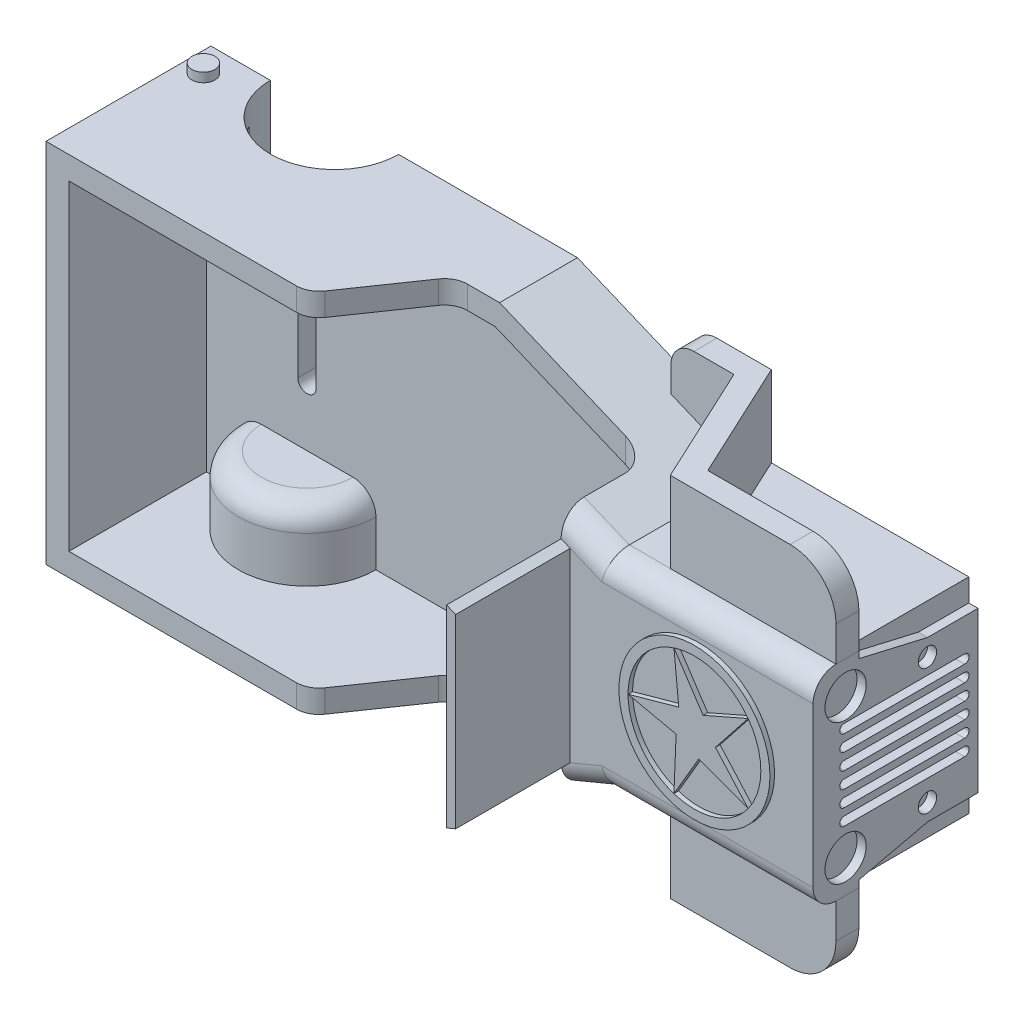
from build123d import *

# Parameters (mm, degrees)
BOSS_EXTRUDE1_DEPTH     = 6
BOSS_EXTRUDE2_DEPTH     = 30
FILLET1_R               = 5
SHELL1_START            = -1
SHELL1_DEPTH            = 26
BOSS_EXTRUDE3_DEPTH     = 30
CUT_EXTRUDE1_DEPTH      = 147.225446215
CUT_EXTRUDE1_DEPTH_BACK = 147.225446215
FILLET2_R               = 5
BOSS_EXTRUDE8_DEPTH     = 15
CUT_EXTRUDE4_DEPTH      = 15
BOSS_EXTRUDE10_START    = -5
BOSS_EXTRUDE10_DEPTH    = 5
FILLET3_R               = 5
FILLET3_OF_MIRROR1_R    = 5
BOSS_EXTRUDE11_REACH    = 163.808
FILLET4_R               = 5
FILLET5_R               = 10
SKETCH16_R              = 4.5
SKETCH16_R_2            = 2
CUT_EXTRUDE5_DEPTH      = 2
CUT_EXTRUDE6_DEPTH      = 2
LPATTERN1_COUNT         = 6
LPATTERN1_PITCH         = 3.5
CUT_EXTRUDE7_DEPTH      = 15
SKETCH19_R              = 2.5
BOSS_EXTRUDE12_DEPTH    = 2
SKETCH20_R              = 3
SKETCH20_R_2            = 2
BOSS_EXTRUDE13_DEPTH    = 2
SKETCH21_R              = 16.488787197
SKETCH21_R_2            = 14.488787197
BOSS_EXTRUDE14_DEPTH    = 1
BOSS_EXTRUDE15_DEPTH    = 25
BOSS_EXTRUDE16_REACH    = 162.079
SKETCH23_W              = 1.975463427
SKETCH23_H              = 1.767939341
BOSS_EXTRUDE17_REACH    = 162.079
SKETCH25_W              = 1.975463427
SKETCH25_H              = 1.028390585
SKETCH26_W              = 22.203670074
SKETCH26_H              = 37.955265754
BOSS_EXTRUDE25_DEPTH    = 2
SKETCH27_R              = 2.5
BOSS_EXTRUDE26_DEPTH    = 11
FILLET6_R               = 1


# Read off the part's stored shape, not the designer's step: Shell1
with BuildPart() as part:
    # Sketch1 → Boss-Extrude1 (new body)
    with BuildSketch(Plane.XY):
        Polygon((-30, -40), (-30, 40), (50, 40), (92.319783532, 22.378793205), (137.411357321, 22.378793205), (137.411357321, -22.378793205), (92.319783532, -22.378793205), (50, -40), align=None)
    extrude(amount=-BOSS_EXTRUDE1_DEPTH)

    # Sketch2 → Boss-Extrude2 (add)
    with BuildSketch(Plane.XY):
        Polygon((82.432198457, 26.495808151), (82.432198457, -26.495808151), (92.319783532, -22.378793205), (137.411357321, -22.378793205), (137.411357321, 22.378793205), (92.319783532, 22.378793205), align=None)
    extrude(amount=BOSS_EXTRUDE2_DEPTH)

    # Fillet1
    fillet1_edges = [part.edges().sort_by_distance(p)[0] for p in [
        (114.865570426, 22.378793205, 30),
        (114.865570426, -22.378793205, 30),
        (87.375990995, 24.437300678, 30),
        (87.375990995, -24.437300678, 30),
    ]]
    fillet(fillet1_edges, radius=FILLET1_R)

    # Shell1 outline → Shell1 (cut)
    with BuildSketch(Plane.XY.offset(SHELL1_START)):
        Polygon((82.432198457, 21.079688275), (82.432198457, -21.079688275), (91.320413667, -17.378793205), (132.411357321, -17.378793205), (132.411357321, 17.378793205), (91.320413667, 17.378793205), align=None)
    extrude(amount=SHELL1_DEPTH, mode=Mode.SUBTRACT)

    # Sketch3 → Boss-Extrude3 (add)
    with BuildSketch(Plane.XY):
        Polygon((82.432198457, 21.079688275), (82.432198457, 26.495808151), (50, 40), (-30, 40), (-30, -40), (50, -40), (82.432198457, -26.495808151), (82.432198457, -21.079688275), (49.000630135, -35), (-25, -35), (-25, 35), (49.000630135, 35), align=None)
    extrude(amount=BOSS_EXTRUDE3_DEPTH)

    # Sketch4 → Cut-Extrude1 (cut, two sides: drawn at the far end of the back side and taken through both)
    with BuildSketch(Plane(origin=(0, 0, 0), x_dir=(1, 0, 0), z_dir=(0, 1, 0)).offset(-CUT_EXTRUDE1_DEPTH_BACK)):
        Polygon((82.432198457, -30), (82.432198457, -11), (40.350619209, -11), (27.257423669, -30), align=None)
    extrude(amount=CUT_EXTRUDE1_DEPTH + CUT_EXTRUDE1_DEPTH_BACK, mode=Mode.SUBTRACT)

    # Fillet2
    fillet2_edges = [part.edges().sort_by_distance(p)[0] for p in [
        (27.257423669, 37.5, 30),
        (40.350619209, -37.5, 11),
        (40.350619209, 37.5, 11),
        (27.257423669, -37.5, 30),
        (82.432198457, -23.787748213, 11),
        (82.432198457, 23.787748213, 11),
    ]]
    fillet(fillet2_edges, radius=FILLET2_R)

    # Sketch10 → Boss-Extrude8 (add)
    with BuildSketch(Plane.XZ.offset(-35)):
        with BuildLine():
            Line((-17.996298407, 0), (-15.996298407, 0))
            ThreePointArc((-15.996298407, 0), (-2.996298407, 13), (10.003701593, 0))
            Line((10.003701593, 0), (12.003701593, 0))
            ThreePointArc((12.003701593, 0), (-2.996298407, 15), (-17.996298407, 0))
        make_face()
    boss_extrude8 = extrude(amount=BOSS_EXTRUDE8_DEPTH)

    # Sketch13 → Cut-Extrude4 (cut)
    with BuildSketch(Plane(origin=(0, 40, 0), x_dir=(1, 0, 0), z_dir=(0, 1, 0))):
        with BuildLine():
            Line((10.961447701, 6.062986143), (-17.038552299, 6.062986143))
            ThreePointArc((-17.038552299, 6.062986143), (-3.038552299, -7.937013857), (10.961447701, 6.062986143))
        make_face()
    cut_extrude4 = extrude(amount=-CUT_EXTRUDE4_DEPTH, mode=Mode.SUBTRACT)

    # Sketch14 → Boss-Extrude10 (add)
    with BuildSketch(Plane.XZ.offset(-20).offset(BOSS_EXTRUDE10_START)):
        with BuildLine():
            Line((-15.996298407, 0), (10.003701593, 0))
            ThreePointArc((10.003701593, 0), (-2.996298407, 13), (-15.996298407, 0))
        make_face()
    boss_extrude10 = extrude(amount=BOSS_EXTRUDE10_DEPTH)

    # Fillet3
    fillet3_edges = [part.edges().sort_by_distance(p)[0] for p in [
        (-2.996298407, 20, 15),
    ]]
    fillet(fillet3_edges, radius=FILLET3_R)

    # Mirror1: Boss-Extrude8, Cut-Extrude4, Boss-Extrude10 across plane
    add(boss_extrude8.mirror(Plane.ZX))
    add(cut_extrude4.mirror(Plane.ZX), mode=Mode.SUBTRACT)
    add(boss_extrude10.mirror(Plane.ZX))

    # Fillet3 of Mirror1
    fillet3_of_mirror1_edges = [part.edges().sort_by_distance(p)[0] for p in [
        (-2.996298407, -20, 15),
    ]]
    fillet(fillet3_of_mirror1_edges, radius=FILLET3_OF_MIRROR1_R)


with BuildPart() as body_2:

    # Sketch15 → Boss-Extrude11 (new, up to next)
    with BuildSketch(Plane.XZ.offset(40), mode=Mode.PRIVATE) as boss_extrude11_sk1:
        Polygon((137.411357321, 20), (104.443782644, 20), (92.319783532, -6), (75.411357321, -6), (75.411357321, -1), (89.134432228, -1), (101.25843134, 25), (137.411357321, 25), align=None)
    boss_extrude11_tool1 = extrude(boss_extrude11_sk1.sketch, amount=-BOSS_EXTRUDE11_REACH, mode=Mode.PRIVATE) - part.part
    add(boss_extrude11_tool1.solids().sort_by_distance((120.92757, -40, 20.693181))[0])

    # Fillet4
    fillet4_edges = [body_2.edges().sort_by_distance(p)[0] for p in [
        (75.411357321, -40, -3.5),
    ]]
    fillet(fillet4_edges, radius=FILLET4_R)

    # Fillet5
    fillet5_edges = [body_2.edges().sort_by_distance(p)[0] for p in [
        (137.411357321, -40, 22.5),
    ]]
    fillet(fillet5_edges, radius=FILLET5_R)


with BuildPart() as body_3:
    # Mirror6: mirrored copy
    add(body_2.part.mirror(Plane.ZX))


with BuildPart() as part_1:
    add(part.part)

    # Sketch16 → Cut-Extrude5 (cut)
    with BuildSketch(Plane(origin=(137.411357321, 0, 0), x_dir=(0, 0, -1), z_dir=(1, 0, 0))):
        with Locations((-22.899735965, -15.27852917)):
            Circle(SKETCH16_R)
        with Locations((-5.025617096, -13.743548647)):
            Circle(SKETCH16_R_2)
        Polygon((-20, -22.378793205), (-20, -20.914327111), (-5.025617096, -17.435957261), (6, -17.435957261), (6, -22.378793205), align=None)
    cut_extrude5 = extrude(amount=-CUT_EXTRUDE5_DEPTH, mode=Mode.SUBTRACT)

    # Mirror7: Cut-Extrude5 across plane
    add(cut_extrude5.mirror(Plane.ZX), mode=Mode.SUBTRACT)

    # Sketch17 → Cut-Extrude6 (cut)
    with BuildSketch(Plane(origin=(137.411357321, 0, 0), x_dir=(0, 0, -1), z_dir=(1, 0, 0))):
        with BuildLine():
            Line((-23.191451637, -7.217675331), (3.084130468, -7.217675331))
            ThreePointArc((3.084130468, -7.217675331), (4.057300175, -8.190845039), (3.084130468, -9.164014747))
            Line((3.084130468, -9.164014747), (-23.191451637, -9.164014747))
            ThreePointArc((-23.191451637, -9.164014747), (-24.164621345, -8.190845039), (-23.191451637, -7.217675331))
        make_face()
    cut_extrude6 = extrude(amount=-CUT_EXTRUDE6_DEPTH, mode=Mode.SUBTRACT)

    # LPattern1: Cut-Extrude6 ×6
    with Locations(*[(0, i * LPATTERN1_PITCH, 0) for i in range(1, LPATTERN1_COUNT)]):
        add(cut_extrude6, mode=Mode.SUBTRACT)

    # Sketch18 → Cut-Extrude7 (cut)
    with BuildSketch(Plane(origin=(0, 0, -6), x_dir=(-1, 0, 0), z_dir=(0, 0, -1))):
        with BuildLine():
            Line((1.038552299, -7.212589188), (1.038552299, 7.212589188))
            ThreePointArc((1.038552299, 7.212589188), (3.038552299, 9.212589188), (5.038552299, 7.212589188))
            Line((5.038552299, 7.212589188), (5.038552299, -7.212589188))
            ThreePointArc((5.038552299, -7.212589188), (3.038552299, -9.212589188), (1.038552299, -7.212589188))
        make_face()
        with BuildLine():
            Line((-108.449909619, -7.212589188), (-108.449909619, 7.212589188))
            ThreePointArc((-108.449909619, 7.212589188), (-110.449909619, 9.212589188), (-112.449909619, 7.212589188))
            Line((-112.449909619, 7.212589188), (-112.449909619, -7.212589188))
            ThreePointArc((-112.449909619, -7.212589188), (-110.449909619, -9.212589188), (-108.449909619, -7.212589188))
        make_face()
    extrude(amount=-CUT_EXTRUDE7_DEPTH, mode=Mode.SUBTRACT)

    # Sketch19 → Boss-Extrude12 (add)
    with BuildSketch(Plane.XZ.offset(40)):
        with Locations((-25.645362132, 0)):
            Circle(SKETCH19_R)
    boss_extrude12 = extrude(amount=BOSS_EXTRUDE12_DEPTH)

    # Sketch20 → Boss-Extrude13 (add)
    with BuildSketch(Plane.ZY.offset(30)):
        with Locations((0, 34.328087823)):
            Circle(SKETCH20_R)
        with Locations((0, 25.516847095)):
            Circle(SKETCH20_R)
        with Locations((6.015006298, 29.922467459)):
            Circle(SKETCH20_R_2)
    boss_extrude13 = extrude(amount=BOSS_EXTRUDE13_DEPTH)

    # Mirror8: Boss-Extrude12, Boss-Extrude13 across plane
    add(boss_extrude12.mirror(Plane.ZX))
    add(boss_extrude13.mirror(Plane.ZX))

    # Sketch21 → Boss-Extrude14 (add)
    # profile 1 of 2: a face of its own
    with BuildSketch(Plane.XY.offset(30)):
        with Locations((112.524843525, 0)):
            Circle(SKETCH21_R)
        with Locations((112.524843525, 0)):
            Circle(SKETCH21_R_2, mode=Mode.SUBTRACT)
    # profile 2 of 2: a face of its own
    with BuildSketch(Plane.XY.offset(30)):
        Polygon((114.416163992, 4.207520775), (108.054540272, 13.769167077), (109.107703641, 3.098948078), (98.048187777, 0.003395586), (108.521614465, -2.292265533), (108.048081483, -13.767068489), (113.467851785, -4.515646089), (124.234708171, -8.511911838), (117.110883741, -0.498557231), (124.238699922, 8.506417664), align=None)
    extrude(amount=BOSS_EXTRUDE14_DEPTH)

    # Sketch22 → Boss-Extrude15 (add)
    with BuildSketch(Plane.XY.offset(30)):
        Polygon((84.407661884, 20.257140364), (82.432198457, 21.079688275), (82.432198457, 18.977632877), (84.407661884, 18.977632877), align=None)
        Polygon((82.432198457, -21.079688275), (84.407661884, -20.257140364), (84.407661884, -18.977632877), (82.432198457, -18.977632877), align=None)
    extrude(amount=BOSS_EXTRUDE15_DEPTH)

    # Sketch23 → Boss-Extrude16 (add, up to next)
    with BuildSketch(Plane(origin=(0, -18.977632877, 0), x_dir=(1, 0, 0), z_dir=(0, 1, 0)), mode=Mode.PRIVATE) as boss_extrude16_sk1:
        with Locations((83.419930171, -54.11603033)):
            Rectangle(SKETCH23_W, SKETCH23_H)
    boss_extrude16_tool1 = extrude(boss_extrude16_sk1.sketch, amount=BOSS_EXTRUDE16_REACH, mode=Mode.PRIVATE) - part_1.part
    add(boss_extrude16_tool1.solids().sort_by_distance((83.41993, -18.977633, 54.11603))[0])

    # Sketch25 → Boss-Extrude17 (add, up to next)
    with BuildSketch(Plane(origin=(0, -18.977632877, 0), x_dir=(1, 0, 0), z_dir=(0, 1, 0)), mode=Mode.PRIVATE) as boss_extrude17_sk1:
        with Locations((83.419930171, -30.514195293)):
            Rectangle(SKETCH25_W, SKETCH25_H)
    boss_extrude17_tool1 = extrude(boss_extrude17_sk1.sketch, amount=BOSS_EXTRUDE17_REACH, mode=Mode.PRIVATE) - part_1.part
    add(boss_extrude17_tool1.solids().sort_by_distance((83.41993, -18.977633, 30.514195))[0])

    # Sketch26 → Boss-Extrude25 (add)
    with BuildSketch(Plane(origin=(84.407661884, 0, 0), x_dir=(0, 0, -1), z_dir=(1, 0, 0))):
        with Locations((-42.130225622, 0)):
            Rectangle(SKETCH26_W, SKETCH26_H)
    extrude(amount=-BOSS_EXTRUDE25_DEPTH)

    # Sketch27 → Boss-Extrude26 (add)
    with BuildSketch(Plane.ZY.offset(30)):
        with Locations((12, 0)):
            Circle(SKETCH27_R)
    extrude(amount=BOSS_EXTRUDE26_DEPTH)

    # Fillet6
    fillet6_edges = [part_1.edges().sort_by_distance(p)[0] for p in [
        (-41, 0, 9.5),
    ]]
    fillet(fillet6_edges, radius=FILLET6_R)


solid = Compound([body_2.part, body_3.part, part_1.part])
